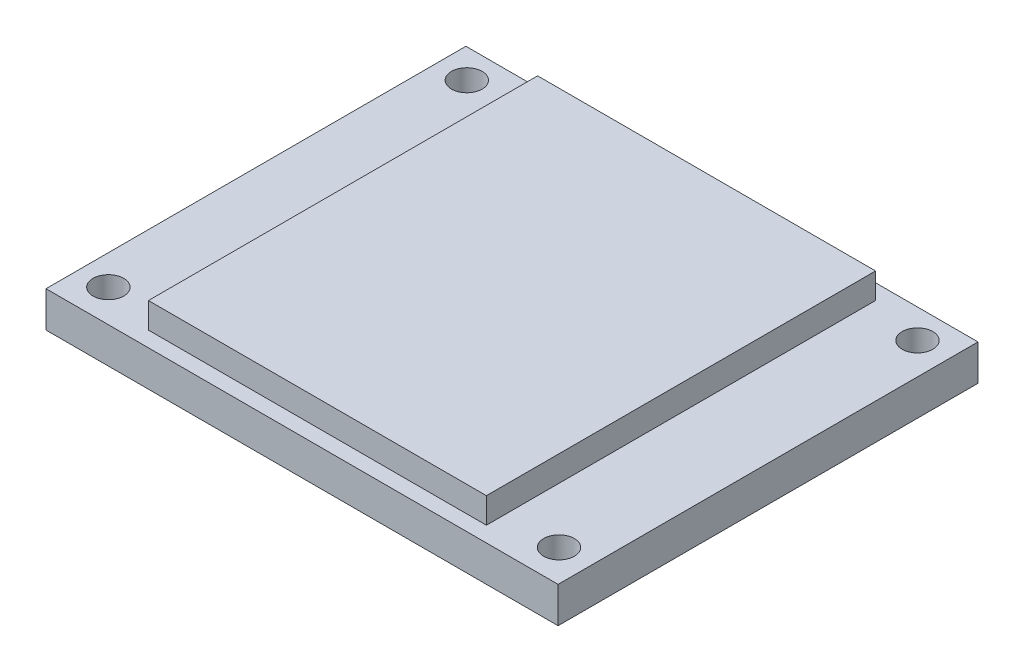
from build123d import *

# Parameters (mm, degrees)
SKETCH1_W           = 50
SKETCH1_H           = 41
BOSS_EXTRUDE1_DEPTH = 3.5
SKETCH2_R           = 1.5
CUT_EXTRUDE1_DEPTH  = 3.5
SKETCH3_W           = 33
SKETCH3_H           = 38
BOSS_EXTRUDE2_DEPTH = 2.5


with BuildPart() as part:
    # Sketch1 → Boss-Extrude1 (new body)
    with BuildSketch(Plane(origin=(0, 0, 0), x_dir=(1, 0, 0), z_dir=(0, 1, 0))):
        with Locations((2.419354839, -6.467741935)):
            Rectangle(SKETCH1_W, SKETCH1_H)
    extrude(amount=BOSS_EXTRUDE1_DEPTH)

    # Sketch2 → Cut-Extrude1 (cut)
    with BuildSketch(Plane(origin=(0, 3.5, 0), x_dir=(1, 0, 0), z_dir=(0, 1, 0))):
        with Locations((-19.662393795, 11.203444037)):
            Circle(SKETCH2_R)
        with Locations((-19.662393795, -23.796555963)):
            Circle(SKETCH2_R)
        with Locations((24.337606205, -23.796657054)):
            Circle(SKETCH2_R)
        with Locations((24.337606205, 11.203342946)):
            Circle(SKETCH2_R)
    extrude(amount=-CUT_EXTRUDE1_DEPTH, mode=Mode.SUBTRACT)

    # Sketch3 → Boss-Extrude2 (add)
    with BuildSketch(Plane(origin=(0, 3.5, 0), x_dir=(1, 0, 0), z_dir=(0, 1, 0))):
        with Locations((2.419354839, -6.467741935)):
            Rectangle(SKETCH3_W, SKETCH3_H)
    extrude(amount=BOSS_EXTRUDE2_DEPTH)


solid = part.part
